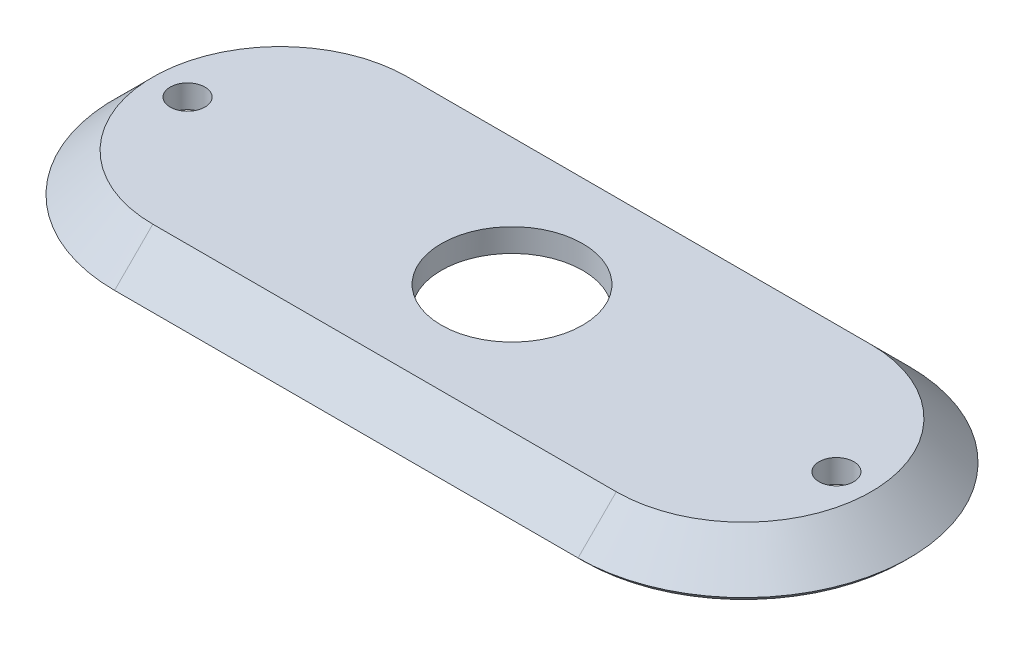
from build123d import *
from OCP.BRepFilletAPI import BRepFilletAPI_MakeChamfer

# Parameters (mm, degrees)
BOSS_EXTRU_1_DEPTH      = 3.8
BOSS_EXTRU_1_TAPER      = 45
COQUE2_DEPTH            = 1.8
COQUE2_DRAFT            = 45
CHANFREIN1_SIZE         = 1
CHANFREIN1_SIZE2        = 0.707106781
ENL_V_MAT_EXTRU_1_REACH = 39.355
ESQUISSE2_R             = 1.5
ENL_V_MAT_EXTRU_2_REACH = 39.215
ESQUISSE3_R             = 6.1


# Read off the part's stored shape, not the designer's step: Coque2
with BuildPart() as part:
    # Esquisse1 → Boss.-Extru.1 (new body)
    with BuildSketch(Plane(origin=(0, 0, 0), x_dir=(1, 0, 0), z_dir=(0, 1, 0))):
        with BuildLine():
            ThreePointArc((-20, 14.8), (-34.8, 0), (-20, -14.8))
            Line((-20, -14.8), (20, -14.8))
            ThreePointArc((20, -14.8), (34.8, 0), (20, 14.8))
            Line((20, 14.8), (-20, 14.8))
        make_face()
    extrude(amount=BOSS_EXTRU_1_DEPTH, taper=BOSS_EXTRU_1_TAPER)


with BuildPart() as coque2_tool:
    # Coque2 outline → Coque2 (with draft: the straight prism first)
    with BuildSketch(Plane(origin=(0, 1.8, 0), x_dir=(1, 0, 0), z_dir=(0, 1, 0))):
        with BuildLine():
            Line((-20, -10.171572875), (20, -10.171572875))
            ThreePointArc((20, -10.171572875), (30.171572875, 0), (20, 10.171572875))
            Line((20, 10.171572875), (-20, 10.171572875))
            ThreePointArc((-20, 10.171572875), (-30.171572875, 0), (-20, -10.171572875))
        make_face()
    extrude(amount=-COQUE2_DEPTH)
    # Coque2: the draft: its side faces are tilted about the plane it starts from
    coque2_sides = [coque2_tool.faces().sort_by_distance(p)[0] for p in [
        (0, 0.9, 10.171572875),
        (30.171572875, 0.9, 0),
        (0, 0.9, -10.171572875),
        (-30.171572875, 0.9, 0),
    ]]
    draft(coque2_sides, Plane(origin=(0, 1.8, 0), x_dir=(1, 0, 0), z_dir=(0, 1, 0)), COQUE2_DRAFT)


with BuildPart() as part_1:
    add(part.part)

    # Coque2: cut by coque2_tool
    add(coque2_tool.part, mode=Mode.SUBTRACT)

    # Chanfrein1: one chamfer whose edges measure the first distance from different faces: ONE call of the kernel's chamfer builder (chamfer() names one face for all edges)
    chanfrein1_edges_1 = [part_1.edges().sort_by_distance(p)[0] for p in [
        (0, 0, -14.8),
        (0, 0, 14.8),
        (-34.8, 0, 0),
    ]]
    chanfrein1_side_1 = [part_1.faces().sort_by_distance(p)[0] for p in [
        (0, 0, -14.043672029),
    ]]
    chanfrein1_edges_2 = [part_1.edges().sort_by_distance(p)[0] for p in [
        (34.8, 0, 0),
    ]]
    chanfrein1_side_2 = [part_1.faces().sort_by_distance(p)[0] for p in [
        (32.9, 1.9, 0),
    ]]
    chanfrein1 = BRepFilletAPI_MakeChamfer(part_1.part.solid().wrapped)
    for e in chanfrein1_edges_1:
        chanfrein1.Add(CHANFREIN1_SIZE, CHANFREIN1_SIZE2, e.wrapped, chanfrein1_side_1[0].wrapped)  # the first distance lies on this face
    for e in chanfrein1_edges_2:
        chanfrein1.Add(CHANFREIN1_SIZE, CHANFREIN1_SIZE2, e.wrapped, chanfrein1_side_2[0].wrapped)  # the first distance lies on this face
    add(Compound.cast(chanfrein1.Shape()), mode=Mode.REPLACE)

    # Esquisse2 → Enlèv. mat.-Extru.1 (cut, up to next)
    with BuildSketch(Plane(origin=(0, 3.8, 0), x_dir=(1, 0, 0), z_dir=(0, 1, 0)), mode=Mode.PRIVATE) as enl_v_mat_extru_1_sk1:
        with Locations(Location((-28, 0, 0), (0, 0, 270))):
            Circle(ESQUISSE2_R)
    enl_v_mat_extru_1_tool1 = extrude(enl_v_mat_extru_1_sk1.sketch, amount=-ENL_V_MAT_EXTRU_1_REACH, mode=Mode.PRIVATE) & part_1.part
    # Esquisse2 → Enlèv. mat.-Extru.1 (cut, up to next)
    with BuildSketch(Plane(origin=(0, 3.8, 0), x_dir=(1, 0, 0), z_dir=(0, 1, 0)), mode=Mode.PRIVATE) as enl_v_mat_extru_1_sk2:
        with Locations(Location((28, 0, 0), (0, 0, 270))):
            Circle(ESQUISSE2_R)
    enl_v_mat_extru_1_tool2 = extrude(enl_v_mat_extru_1_sk2.sketch, amount=-ENL_V_MAT_EXTRU_1_REACH, mode=Mode.PRIVATE) & part_1.part
    add(enl_v_mat_extru_1_tool1.solids().sort_by_distance((-28, 3.8, 0))[0], mode=Mode.SUBTRACT)
    add(enl_v_mat_extru_1_tool2.solids().sort_by_distance((28, 3.8, 0))[0], mode=Mode.SUBTRACT)

    # Esquisse3 → Enlèv. mat.-Extru.2 (cut, up to next)
    with BuildSketch(Plane.XZ.offset(-1.8), mode=Mode.PRIVATE) as enl_v_mat_extru_2_sk1:
        with Locations(Location((0, 0, 0), (0, 0, 270))):
            Circle(ESQUISSE3_R)
    enl_v_mat_extru_2_tool1 = extrude(enl_v_mat_extru_2_sk1.sketch, amount=-ENL_V_MAT_EXTRU_2_REACH, mode=Mode.PRIVATE) & part_1.part
    add(enl_v_mat_extru_2_tool1.solids().sort_by_distance((0, 1.8, 0))[0], mode=Mode.SUBTRACT)


solid = part_1.part
